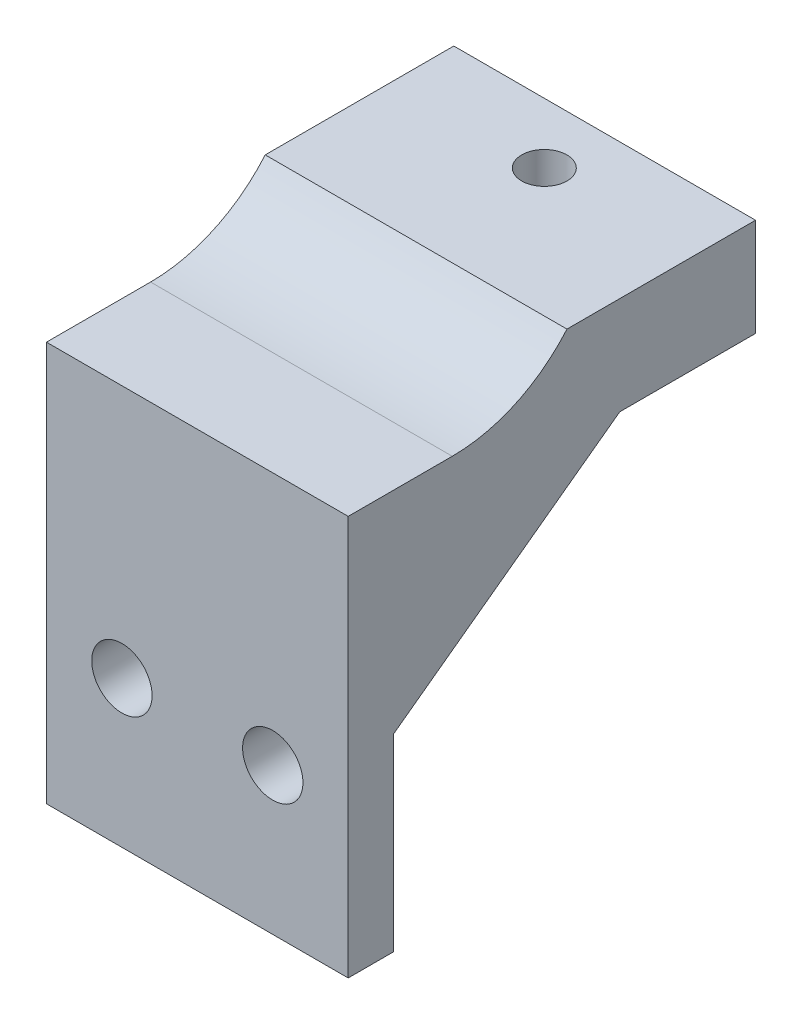
from build123d import *

# Parameters (mm, degrees)
SKETCH_1_W          = 20
SKETCH_1_H          = 26.5
SKETCH_1_R          = 2
EXTRUDE_1_DEPTH     = 3
SKETCH_2_W          = 20
SKETCH_2_H          = 3
EXTRUDE_2_DEPTH     = 24
EXTRUDE_3_DEPTH     = 2
SKETCH_5_W          = 12.5
SKETCH_5_H          = 3.5
EXTRUDE_4_DEPTH     = 20
SKETCH_4_R          = 1.5
CUT_EXTRUDE_1_DEPTH = 10
FILLET_1_R          = 10


with BuildPart() as part:
    # 草图1 → 凸台-拉伸1 (new body)
    with BuildSketch(Plane.XY):
        with Locations((10, -41.75)):
            Rectangle(SKETCH_1_W, SKETCH_1_H)
        with Locations((5, -45.291502622)):
            Circle(SKETCH_1_R, mode=Mode.SUBTRACT)
        with Locations((15, -45.291502622)):
            Circle(SKETCH_1_R, mode=Mode.SUBTRACT)
    extrude(amount=EXTRUDE_1_DEPTH)

    # 草图2 → 凸台-拉伸2 (add)
    with BuildSketch(Plane.XY):
        with Locations((10, -30)):
            Rectangle(SKETCH_2_W, SKETCH_2_H)
    extrude(amount=-EXTRUDE_2_DEPTH)

    # 草图3 → 凸台-拉伸3 (add)
    with BuildSketch(Plane(origin=(0, 0, 0), x_dir=(0, 0, -1), z_dir=(1, 0, 0))):
        Polygon((0, -31.5), (0, -42.5), (15, -31.5), align=None)
    extrude_3 = extrude(amount=EXTRUDE_3_DEPTH)

    # 镜向1: 凸台-拉伸3 across plane
    add(extrude_3.mirror(Plane(origin=(10, 0, 0), x_dir=(0, 0, 1), z_dir=(1, 0, 0))))

    # 草图5 → 凸台-拉伸4 (add)
    with BuildSketch(Plane(origin=(0, 0, 0), x_dir=(0, 0, -1), z_dir=(1, 0, 0))):
        with Locations((17.75, -26.75)):
            Rectangle(SKETCH_5_W, SKETCH_5_H)
    extrude(amount=EXTRUDE_4_DEPTH)

    # 草图4 → 切除-拉伸1 (cut, symmetric)
    with BuildSketch(Plane(origin=(0, -28.5, 0), x_dir=(1, 0, 0), z_dir=(0, 1, 0))):
        with Locations(Location((10, 20, 0), (0, 0, 270))):
            Circle(SKETCH_4_R)
    extrude(amount=CUT_EXTRUDE_1_DEPTH, both=True, mode=Mode.SUBTRACT)

    # 圆角1
    # the kernel refuses this fillet: 10 mm, written as the material it adds along each edge
    with BuildSketch(Plane(origin=(0, -28.5, -11.5), x_dir=(0, 0, 1), z_dir=(1, 0, 0))) as fillet_1_piece_1:
        with BuildLine():
            CenterArc((7.599342077, -10), FILLET_1_R, 90, 49.458398126)
            Line((0, -3.5), (-0.151986842, -3.37))
            ThreePointArc((-0.151986842, -3.37), (-0.2, -1.75), (-0.2, 0))
            Line((-0.2, 0), (0, 0.2))
            Line((0, 0.2), (7.599342077, 0.2))
            Line((7.599342077, 0.2), (7.599342077, 0))
        make_face()
    extrude(amount=20)


solid = part.part
